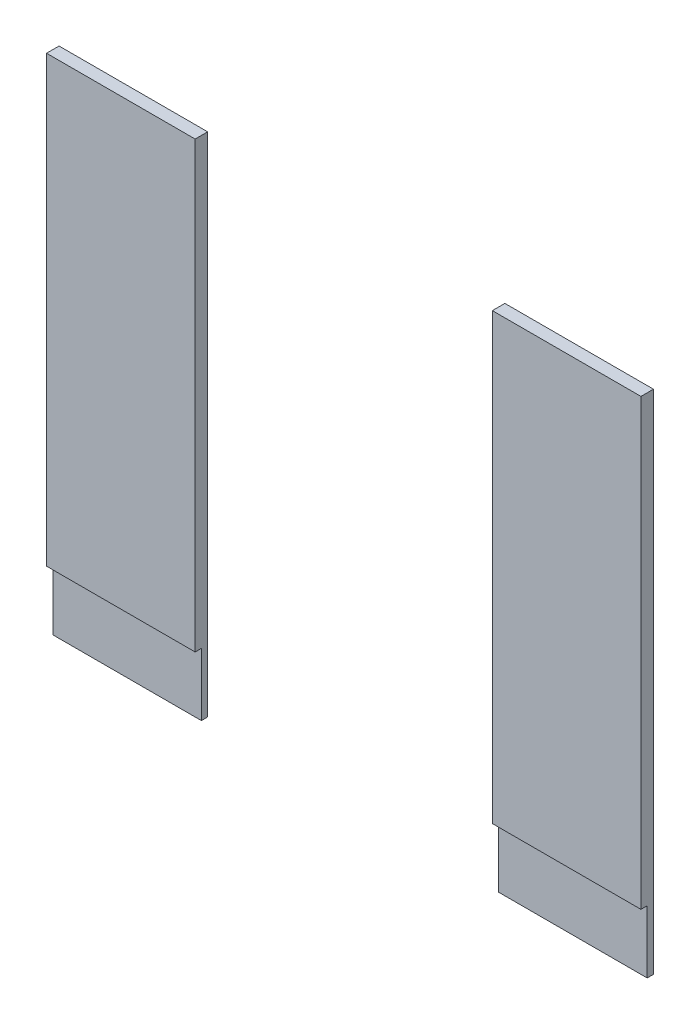
from build123d import *

# Parameters (mm, degrees)
SKETCH2_W             = 237.5
SKETCH2_H             = 710
BOSS_EXTRUDE1_DEPTH   = 10
BOSS_EXTRUDE1_2_DEPTH = 10
SKETCH3_W             = 237.5
SKETCH3_H             = 10
BOSS_EXTRUDE2_DEPTH   = 100


with BuildPart() as part:
    # Sketch2 → Boss-Extrude1 (new, symmetric)
    with BuildSketch(Plane.XY):
        with Locations((-356.25, -355)):
            Rectangle(SKETCH2_W, SKETCH2_H)
    extrude(amount=BOSS_EXTRUDE1_DEPTH, both=True)



with BuildPart() as body_2:
    # Sketch2 → Boss-Extrude1 2 (new, symmetric)
    with BuildSketch(Plane.XY):
        with Locations((356.25, -355)):
            Rectangle(SKETCH2_W, SKETCH2_H)
    extrude(amount=BOSS_EXTRUDE1_2_DEPTH, both=True)


with BuildPart() as part_1:
    add(part.part)

    add(body_2.part)  # Boss-Extrude2 merges body 2
    # Sketch3 → Boss-Extrude2 (add)
    with BuildSketch(Plane.XZ.offset(710)):
        with Locations((-356.25, -5)):
            Rectangle(SKETCH3_W, SKETCH3_H)
        with Locations((356.25, -5)):
            Rectangle(SKETCH3_W, SKETCH3_H)
    extrude(amount=BOSS_EXTRUDE2_DEPTH)


solid = part_1.part
